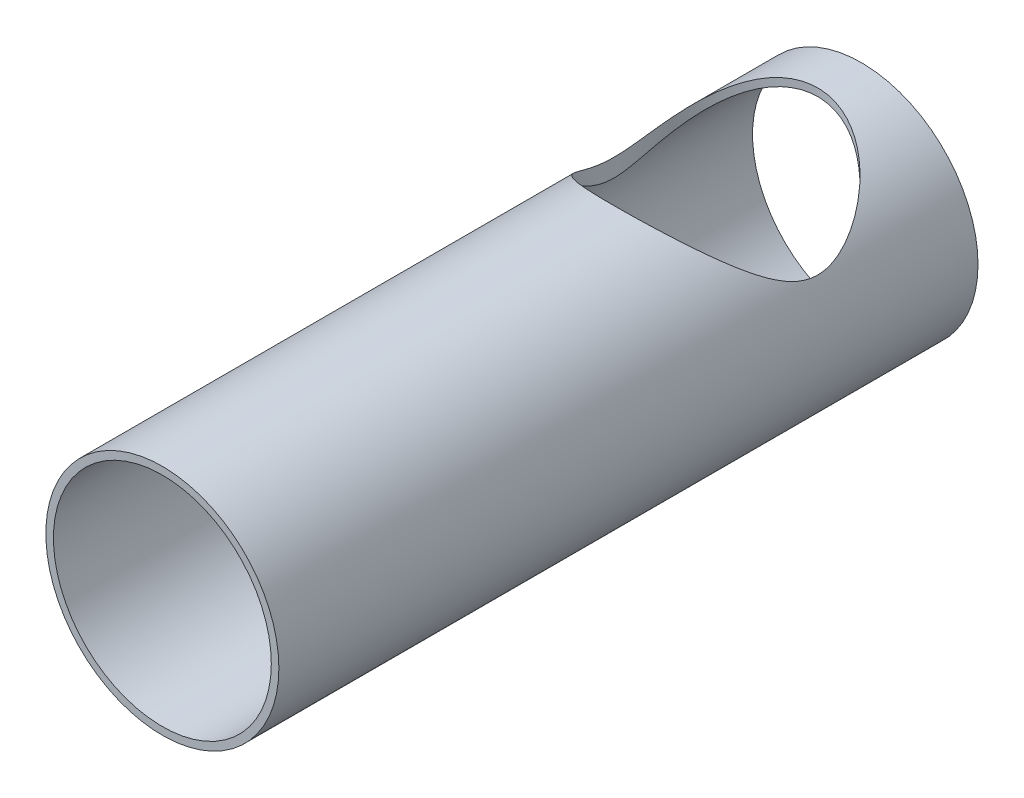
from build123d import *

# Parameters (mm, degrees)
SKETCH1_R           = 25.4
SKETCH1_R_2         = 23.749
BOSS_EXTRUDE1_DEPTH = 152.4
SKETCH2_R           = 22.225
CUT_EXTRUDE2_DEPTH  = 22.86


with BuildPart() as part:
    # Sketch1 → Boss-Extrude1 (new body)
    with BuildSketch(Plane.XY):
        Circle(SKETCH1_R)
        Circle(SKETCH1_R_2, mode=Mode.SUBTRACT)
    extrude(amount=BOSS_EXTRUDE1_DEPTH)

    # Sketch2 → Cut-Extrude2 (cut)
    with BuildSketch(Plane(origin=(0, 25.4, 0), x_dir=(-1, 0, 0), z_dir=(0, 1, 0))):
        with Locations((0, 31.75)):
            Circle(SKETCH2_R)
    extrude(amount=-CUT_EXTRUDE2_DEPTH, mode=Mode.SUBTRACT)


solid = part.part
